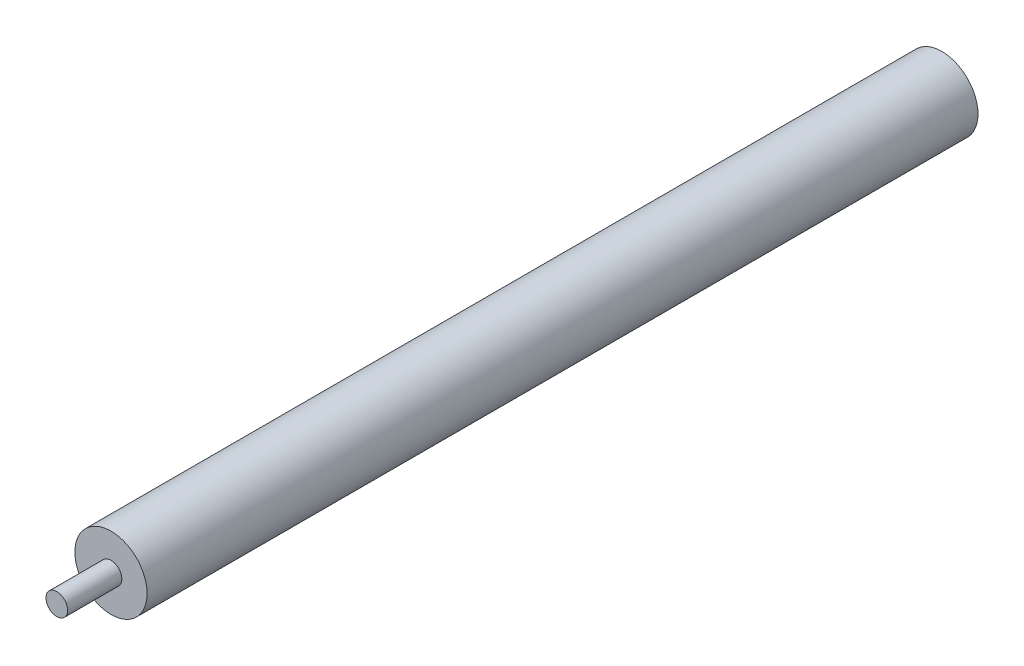
from build123d import *

# Parameters (mm, degrees)
SKETCH1_R           = 10
BOSS_EXTRUDE1_DEPTH = 230
SKETCH2_R           = 3
BOSS_EXTRUDE2_DEPTH = 15


with BuildPart() as part:
    # Sketch1 → Boss-Extrude1 (new body)
    with BuildSketch(Plane.XY):
        Circle(SKETCH1_R)
    extrude(amount=BOSS_EXTRUDE1_DEPTH)

    # Sketch2 → Boss-Extrude2 (add)
    with BuildSketch(Plane.XY.offset(230)):
        Circle(SKETCH2_R)
    extrude(amount=BOSS_EXTRUDE2_DEPTH)


solid = part.part
